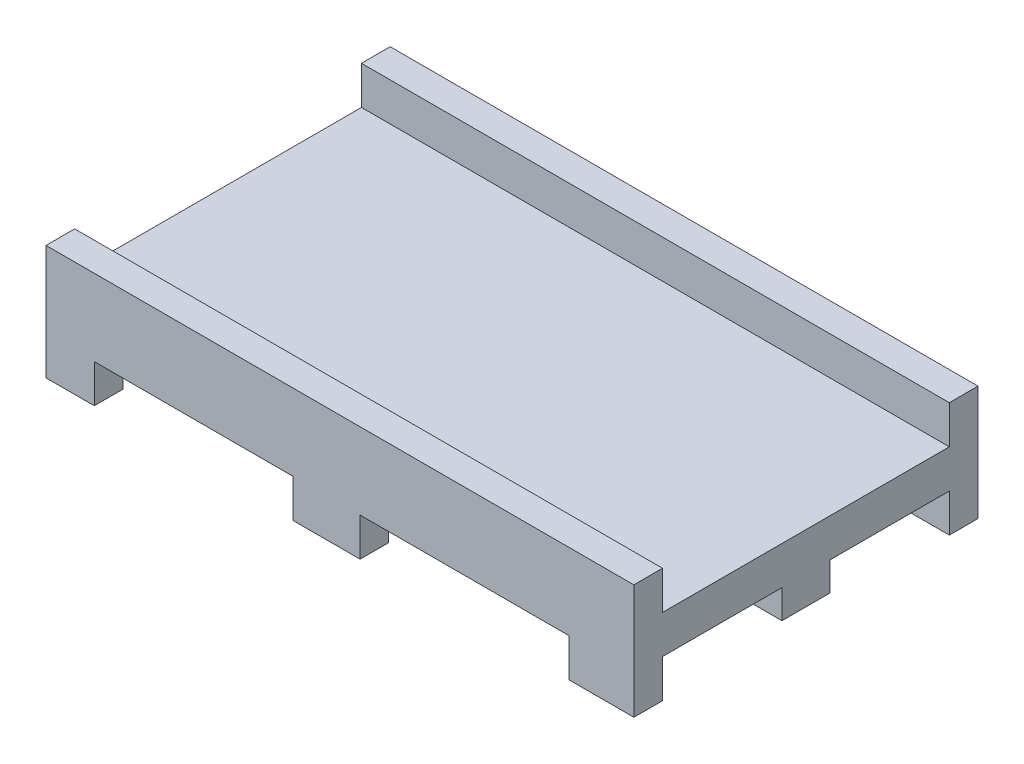
from build123d import *

# Parameters (mm, degrees)
SKETCH1_W               = 104.14
SKETCH1_H               = 3.81
BOSS_EXTRUDE1_DEPTH     = 5.08
BOSS_EXTRUDE1_2_DEPTH   = 5.08
SKETCH2_W               = 104.14
SKETCH2_H               = 45.72
BOSS_EXTRUDE2_DEPTH     = 5.08
SKETCH3_W               = 104.14
SKETCH3_H               = 3.81
BOSS_EXTRUDE3_DEPTH     = 5.08
SKETCH4_W               = 104.14
SKETCH4_H               = 6.3754
BOSS_EXTRUDE4_DEPTH     = 3.81
CUT_EXTRUDE1_DEPTH      = 71.949706835
CUT_EXTRUDE1_DEPTH_BACK = 71.949706835
SKETCH5_W               = 26.368614406
SKETCH5_H               = 5.08
SKETCH5_W_2             = 27.756452018
SKETCH5_W_3             = 30.305435834
SKETCH5_H_2             = 26.045246771


with BuildPart() as part:
    # Sketch1 → Boss-Extrude1 (new body)
    with BuildSketch(Plane(origin=(0, 0, 0), x_dir=(1, 0, 0), z_dir=(0, 1, 0))):
        with Locations((0, -20.955)):
            Rectangle(SKETCH1_W, SKETCH1_H)
    extrude(amount=BOSS_EXTRUDE1_DEPTH)



with BuildPart() as body_2:
    # Sketch1 → Boss-Extrude1 2 (new body)
    with BuildSketch(Plane(origin=(0, 0, 0), x_dir=(1, 0, 0), z_dir=(0, 1, 0))):
        with Locations((0, 20.955)):
            Rectangle(SKETCH1_W, SKETCH1_H)
    extrude(amount=BOSS_EXTRUDE1_2_DEPTH)


with BuildPart() as part_1:
    add(part.part)

    add(body_2.part)  # Boss-Extrude2 merges body 2
    # Sketch2 → Boss-Extrude2 (add)
    with BuildSketch(Plane(origin=(0, 5.08, 0), x_dir=(1, 0, 0), z_dir=(0, 1, 0))):
        Rectangle(SKETCH2_W, SKETCH2_H)
    extrude(amount=BOSS_EXTRUDE2_DEPTH)

    # Sketch3 → Boss-Extrude3 (add)
    with BuildSketch(Plane(origin=(0, 10.16, 0), x_dir=(1, 0, 0), z_dir=(0, 1, 0))):
        with Locations((0, -20.955)):
            Rectangle(SKETCH3_W, SKETCH3_H)
        with Locations((0, 20.955)):
            Rectangle(SKETCH3_W, SKETCH3_H)
    extrude(amount=BOSS_EXTRUDE3_DEPTH)

    # Sketch4 → Boss-Extrude4 (add)
    with BuildSketch(Plane.XZ.offset(-5.08)):
        Rectangle(SKETCH4_W, SKETCH4_H)
    extrude(amount=BOSS_EXTRUDE4_DEPTH)

    # Sketch5 → Cut-Extrude1 (cut, two sides: drawn at the far end of the back side and taken through both)
    with BuildSketch(Plane.XY.offset(22.86).offset(-CUT_EXTRUDE1_DEPTH_BACK)):
        with Locations((-32.471537131, 2.54)):
            Rectangle(SKETCH5_W, SKETCH5_H)
        with Locations((3.530263491, 2.54)):
            Rectangle(SKETCH5_W_2, SKETCH5_H)
        with Locations((41.178408022, 7.587510726)):
            Rectangle(SKETCH5_W_3, SKETCH5_H_2)
    extrude(amount=CUT_EXTRUDE1_DEPTH + CUT_EXTRUDE1_DEPTH_BACK, mode=Mode.SUBTRACT)


solid = part_1.part
